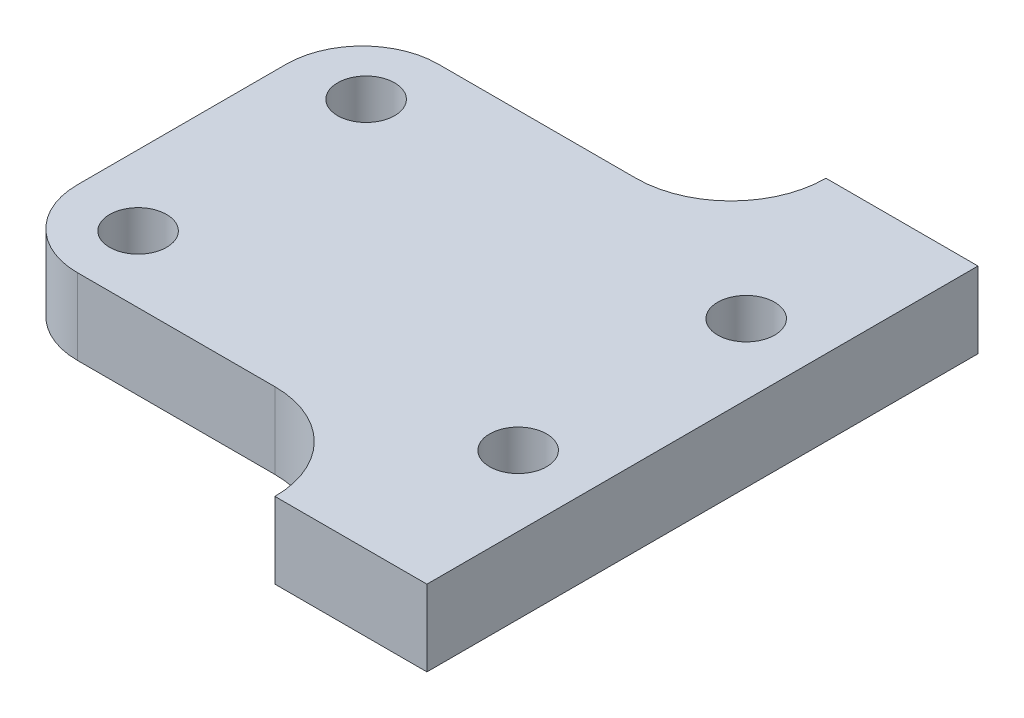
from build123d import *

# Parameters (mm, degrees)
SKETCH_1_W          = 27.399999997
SKETCH_1_H          = 4
EXTRUDE_1_DEPTH     = 3
SKETCH_1_3_W        = 27.399999997
SKETCH_1_3_H        = 4
EXTRUDE_2_DEPTH     = 11
SKETCH_1_4_W        = 27.399999997
SKETCH_1_4_H        = 4
EXTRUDE_3_DEPTH     = 8
SKETCH_2_R          = 1.5
CUT_EXTRUDE_1_DEPTH = 6.5
FILLET_1_R          = 4
EXTRUDE_4_DEPTH     = 19
SKETCH_6_W          = 32.257266432
SKETCH_6_H          = 23.708854684
CUT_EXTRUDE_2_DEPTH = 21
SKETCH_7_W          = 8
SKETCH_7_H          = 4
EXTRUDE_5_DEPTH     = 5
SKETCH_8_W          = 8
SKETCH_8_H          = 4
EXTRUDE_6_DEPTH     = 5
SKETCH_9_W          = 47.208598766
SKETCH_9_H          = 30.653056474
CUT_EXTRUDE_3_DEPTH = 18
FILLET_2_R          = 5


with BuildPart() as part:
    # 草图1 → 凸台-拉伸1 (new body)
    with BuildSketch(Plane.XY):
        with BuildLine():
            ThreePointArc((-0.337371922, -1.853501365), (-0.488220409, -1.87454383), (-0.640366957, -1.881577989))
            Line((-0.640366957, -1.881577989), (-1.640366957, -1.881577989))
            Line((-1.640366957, -1.881577989), (-1.640366957, -2.881577989))
            Line((-1.640366957, -2.881577989), (25.75963304, -2.881577989))
            Line((25.75963304, -2.881577989), (25.75963304, -1.88157799))
            Line((25.75963304, -1.88157799), (24.75963304, -1.88157799))
            ThreePointArc((24.75963304, -1.88157799), (24.607486492, -1.87454383), (24.456638005, -1.853501365))
            ThreePointArc((24.456638005, -1.853501365), (23.608703525, -1.413476758), (23.147062635, -0.577114262))
            ThreePointArc((23.147062635, -0.577114262), (22.880535784, 0.365382964), (22.493851477, 1.265278974))
            ThreePointArc((22.493851477, 1.265278974), (21.584633042, 1.287629087), (20.675414607, 1.265278974))
            ThreePointArc((20.675414607, 1.265278974), (20.288730299, 0.365382964), (20.022203448, -0.577114261))
            ThreePointArc((20.022203448, -0.577114261), (19.560562558, -1.413476758), (18.712628078, -1.853501365))
            ThreePointArc((18.712628078, -1.853501365), (18.409633042, -1.88157799), (18.106638005, -1.853501365))
            ThreePointArc((18.106638005, -1.853501365), (17.258703525, -1.413476758), (16.797062635, -0.577114262))
            ThreePointArc((16.797062635, -0.577114262), (16.530535784, 0.365382964), (16.143851477, 1.265278974))
            ThreePointArc((16.143851477, 1.265278974), (15.234633042, 1.287629087), (14.325414607, 1.265278974))
            ThreePointArc((14.325414607, 1.265278974), (13.938730299, 0.365382964), (13.672203448, -0.577114261))
            ThreePointArc((13.672203448, -0.577114261), (13.210562558, -1.413476758), (12.362628078, -1.853501365))
            ThreePointArc((12.362628078, -1.853501365), (12.059633042, -1.88157799), (11.756638005, -1.853501365))
            ThreePointArc((11.756638005, -1.853501365), (10.908703525, -1.413476758), (10.447062635, -0.577114262))
            ThreePointArc((10.447062635, -0.577114262), (10.180535784, 0.365382964), (9.793851477, 1.265278974))
            ThreePointArc((9.793851477, 1.265278974), (8.884633042, 1.287629087), (7.975414607, 1.265278974))
            ThreePointArc((7.975414607, 1.265278974), (7.588730299, 0.365382964), (7.322203448, -0.577114261))
            ThreePointArc((7.322203448, -0.577114261), (6.860562558, -1.413476758), (6.012628078, -1.853501365))
            ThreePointArc((6.012628078, -1.853501365), (5.709633042, -1.88157799), (5.406638005, -1.853501365))
            ThreePointArc((5.406638005, -1.853501365), (4.558703525, -1.413476758), (4.097062635, -0.577114262))
            ThreePointArc((4.097062635, -0.577114262), (3.830535784, 0.365382964), (3.443851477, 1.265278974))
            ThreePointArc((3.443851477, 1.265278974), (2.534633042, 1.287629087), (1.625414607, 1.265278974))
            ThreePointArc((1.625414607, 1.265278974), (1.238730299, 0.365382964), (0.972203448, -0.577114261))
            ThreePointArc((0.972203448, -0.577114261), (0.510562558, -1.413476758), (-0.337371922, -1.853501365))
        make_face()
        with Locations((12.059633041, -4.881577989)):
            Rectangle(SKETCH_1_W, SKETCH_1_H)
    extrude(amount=EXTRUDE_1_DEPTH)

    # 草图1<3> → 凸台-拉伸2 (add)
    with BuildSketch(Plane.XY):
        with Locations((12.059633041, -4.881577989)):
            Rectangle(SKETCH_1_3_W, SKETCH_1_3_H)
    extrude(amount=EXTRUDE_2_DEPTH)

    # 草图1<4> → 凸台-拉伸3 (add)
    with BuildSketch(Plane.XY):
        with Locations((12.059633041, -4.881577989)):
            Rectangle(SKETCH_1_4_W, SKETCH_1_4_H)
    extrude(amount=-EXTRUDE_3_DEPTH)

    # 草图2 → 切除-拉伸1 (cut)
    with BuildSketch(Plane(origin=(0, -2.881577989, 0), x_dir=(1, 0, 0), z_dir=(0, 1, 0))):
        with Locations(Location((2.059633042, 4.5, 0), (0, 0, 270))):
            Circle(SKETCH_2_R)
        with Locations(Location((22.059633042, 4.5, 0), (0, 0, 270))):
            Circle(SKETCH_2_R)
        with Locations(Location((22.059633042, -7.5, 0), (0, 0, 270))):
            Circle(SKETCH_2_R)
        with Locations(Location((2.059633042, -7.5, 0), (0, 0, 270))):
            Circle(SKETCH_2_R)
    extrude(amount=-CUT_EXTRUDE_1_DEPTH, mode=Mode.SUBTRACT)

    # 圆角1
    fillet_1_edges = [part.edges().sort_by_distance(p)[0] for p in [
        (-1.640366957, -4.881577989, 11),
        (-1.640366957, -4.881577989, -8),
    ]]
    fillet(fillet_1_edges, radius=FILLET_1_R)

    # 草图4 → 凸台-拉伸4 (add)
    with BuildSketch(Plane(origin=(0, 0, -8), x_dir=(-1, 0, 0), z_dir=(0, 0, -1))):
        with BuildLine():
            Line((-11.559633042, -6.881577989), (-16.559633042, -6.881577989))
            Line((-16.559633042, -6.881577989), (-16.559633042, -12.881577989))
            ThreePointArc((-16.559633042, -12.881577989), (-11.842889335, -20.796987993), (-2.636585146, -20.415740147))
            Line((-2.636585146, -20.415740147), (-2.636585146, -19.612245623))
            ThreePointArc((-2.636585146, -19.612245623), (-8.775001634, -18.470018526), (-11.559633042, -12.881577989))
            Line((-11.559633042, -12.881577989), (-11.559633042, -6.881577989))
        make_face()
    extrude(amount=-EXTRUDE_4_DEPTH)

    # 草图6 → 切除-拉伸2 (cut)
    with BuildSketch(Plane.XZ.offset(6.881577989)):
        with Locations((13.405653676, 0.508195322)):
            Rectangle(SKETCH_6_W, SKETCH_6_H)
    extrude(amount=CUT_EXTRUDE_2_DEPTH, mode=Mode.SUBTRACT)

    # 草图7 → 凸台-拉伸5 (add)
    with BuildSketch(Plane.XY.offset(11)):
        with Locations((21.75963304, -4.881577989)):
            Rectangle(SKETCH_7_W, SKETCH_7_H)
    extrude(amount=EXTRUDE_5_DEPTH)

    # 草图8 → 凸台-拉伸6 (add)
    with BuildSketch(Plane(origin=(0, 0, -8), x_dir=(-1, 0, 0), z_dir=(0, 0, -1))):
        with Locations((-21.75963304, -4.881577989)):
            Rectangle(SKETCH_8_W, SKETCH_8_H)
    extrude(amount=EXTRUDE_6_DEPTH)

    # 草图9 → 切除-拉伸3 (cut)
    with BuildSketch(Plane(origin=(0, -2.881577989, 0), x_dir=(1, 0, 0), z_dir=(0, 1, 0))):
        with Locations((10.799915409, -0.879700666)):
            Rectangle(SKETCH_9_W, SKETCH_9_H)
    extrude(amount=CUT_EXTRUDE_3_DEPTH, mode=Mode.SUBTRACT)

    # 圆角2
    fillet_2_edges = [part.edges().sort_by_distance(p)[0] for p in [
        (17.75963304, -4.881577989, 11),
        (17.75963304, -4.881577989, -8),
    ]]
    fillet(fillet_2_edges, radius=FILLET_2_R - 0.0001)  # a hair under: the kernel refuses the full size


solid = part.part
